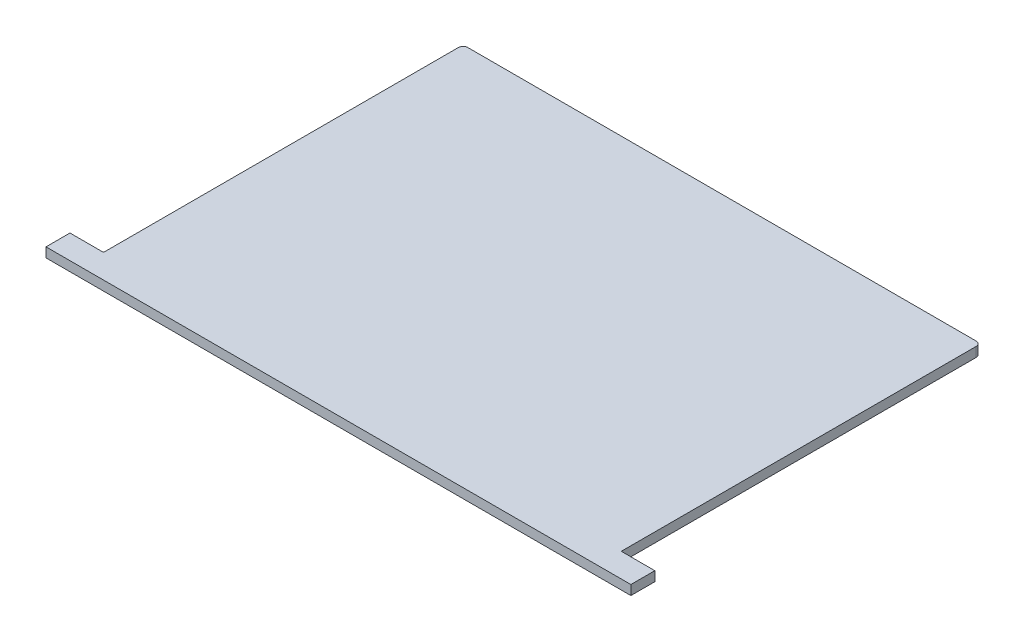
from build123d import *

# Parameters (mm, degrees)
BOSS_EXTRUDE1_DEPTH = 1
FILLET1_R           = 0.5


with BuildPart() as part:
    # Sketch1 → Boss-Extrude1 (new body)
    with BuildSketch(Plane(origin=(0, 0, 0), x_dir=(1, 0, 0), z_dir=(0, 1, 0))):
        Polygon((-27, -20), (27, -20), (30.5, -20), (30.5, -17.5), (27, -17.5), (27, 20), (-27, 20), (-27, -17.5), (-30.5, -17.5), (-30.5, -20), align=None)
    extrude(amount=BOSS_EXTRUDE1_DEPTH)

    # Fillet1
    fillet1_edges = [part.edges().sort_by_distance(p)[0] for p in [
        (27, 0.5, -20),
        (-27, 0.5, -20),
    ]]
    fillet(fillet1_edges, radius=FILLET1_R)


solid = part.part
